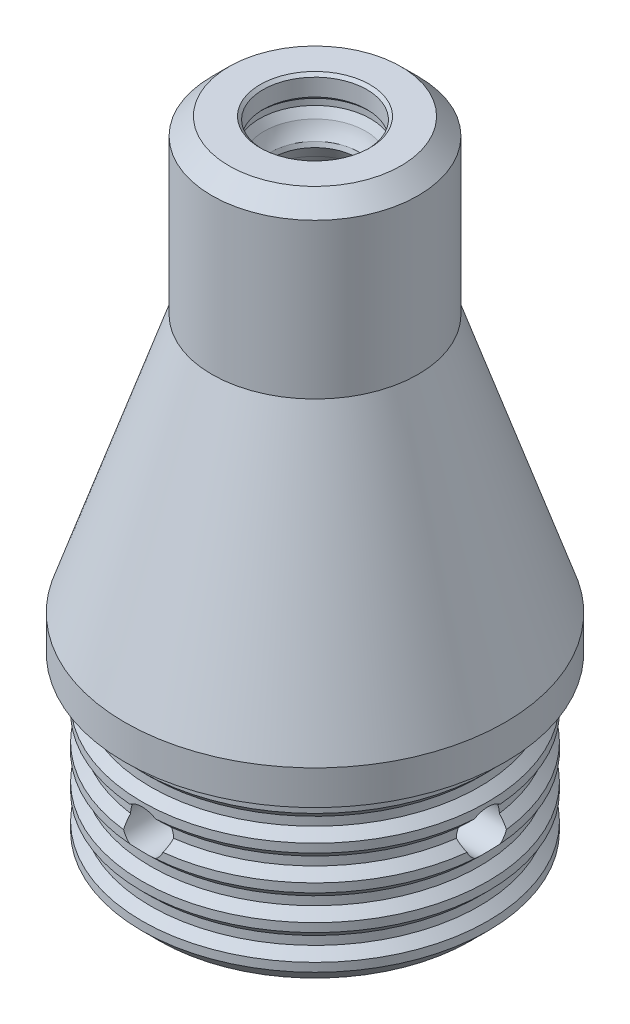
from build123d import *

# Parameters (mm, degrees)
CHAMFER_1_SIZE           = 1
CHAMFER_2_SIZE           = 0.1
CHAMFER_3_SIZE           = 1
SKETCH_2_R               = 1.25
CUT_EXTRUDE_1_DEPTH      = 5
PATTERN_CIRCULAR_1_COUNT = 4
CHAMFER_4_SIZE           = 0.5


with BuildPart() as part:
    # 스케치1 → 회전1 (revolve)
    with BuildSketch(Plane(origin=(0, 0, 0), x_dir=(0, 0, -1), z_dir=(1, 0, 0))):
        with BuildLine():
            Line((4.2, 0), (4.2, 1))
            Line((4.2, 1), (4.7, 1.500000078))
            Line((4.7, 1.500000078), (4.7, 2.000000078))
            Line((4.7, 2.000000078), (4.2, 2.5))
            Line((4.2, 2.5), (4.2, 4))
            Line((4.2, 4), (4.7, 4.500000078))
            Line((4.7, 4.500000078), (4.7, 5.000000078))
            Line((4.7, 5.000000078), (4.2, 5.5))
            Line((4.2, 5.5), (4.2, 7))
            Line((4.2, 7), (4.7, 7.500000078))
            Line((4.7, 7.500000078), (4.7, 8.000000078))
            Line((4.7, 8.000000078), (4.2, 8.5))
            Line((4.2, 8.5), (4.2, 10))
            Line((4.2, 10), (4.7, 10.500000078))
            Line((4.7, 10.500000078), (4.7, 11.000000078))
            Line((4.7, 11.000000078), (4.2, 11.5))
            Line((4.2, 11.5), (4.2, 13))
            Line((4.2, 13), (4.7, 13.500000078))
            Line((4.7, 13.500000078), (4.7, 14.000000078))
            Line((4.7, 14.000000078), (4.2, 14.5))
            Line((4.2, 14.5), (4.2, 28))
            Line((4.2, 28), (3.533728258, 29.430530536))
            Line((3.533728258, 29.430530536), (2.802745502, 31))
            Line((2.802745502, 31), (2.399244734, 31.778552392))
            ThreePointArc((2.399244734, 31.778552392), (2.719290067, 32.253174869), (2.946609162, 32.778552392))
            Line((2.946609162, 32.778552392), (3.229990685, 33.260397004))
            Line((3.229990685, 33.260397004), (3.229990685, 33.62037773))
            Line((3.229990685, 33.62037773), (3.02, 33.830368416))
            Line((3.02, 33.830368416), (3.02, 34.830368416))
            Line((3.02, 34.830368416), (3.189631584, 35))
            Line((3.189631584, 35), (6, 35))
            Line((6, 35), (6, 25))
            Line((6, 25), (11.05, 10))
            Line((11.05, 10), (11.05, 8))
            Line((11.05, 8), (10.05, 8))
            Line((10.05, 8), (10.05, 7))
            Line((10.05, 7), (9.55, 6.5))
            Line((9.55, 6.5), (9.55, 6))
            Line((9.55, 6), (10.05, 5.5))
            Line((10.05, 5.5), (10.05, 5))
            Line((10.05, 5), (9.55, 4.5))
            Line((9.55, 4.5), (9.55, 4))
            Line((9.55, 4), (10.05, 3.5))
            Line((10.05, 3.5), (10.05, 3))
            Line((10.05, 3), (9.55, 2.5))
            Line((9.55, 2.5), (9.55, 2))
            Line((9.55, 2), (10.05, 1.5))
            Line((10.05, 1.5), (10.05, 1))
            Line((10.05, 1), (9.55, 0.5))
            Line((9.55, 0.5), (9.55, 0))
            Line((9.55, 0), (10.05, -0.5))
            Line((10.05, -0.5), (10.05, -1))
            Line((10.05, -1), (10.05, -1.999374902))
            Line((10.05, -1.999374902), (4.2, -1.999374902))
            Line((4.2, -1.999374902), (4.2, 0))
        make_face()
    revolve(axis=Axis((0, 0, 0), (0, 1, 0)))

    # 모따기1
    chamfer_1_edges = [part.edges().sort_by_distance(p)[0] for p in [
        (0, 35, 6),
        (0, -1.999374902, 4.2),
    ]]
    chamfer(chamfer_1_edges, length=CHAMFER_1_SIZE)

    # 모따기2
    # the kernel refuses this chamfer: 0.191354542, 0.1 mm, written as the material it takes off along each edge
    with BuildSketch(Plane(origin=(0, 31.778552392, 0), x_dir=(0, 0, -1), z_dir=(1, 0, 0))) as chamfer_2_piece_1:
        with BuildLine():
            Line((2.399244734 + CHAMFER_2_SIZE * 0.460143640426, -CHAMFER_2_SIZE * 0.887844485355), (2.52619809, 0.166311611))
            ThreePointArc((2.52619809, 0.166311611), (2.466310937, 0.08495162), (2.399244734, 0))
            Line((2.399244734, 0), (2.399244734 + CHAMFER_2_SIZE * 0.460143640426, -CHAMFER_2_SIZE * 0.887844485355))
        make_face()
    revolve(axis=Axis((0, 31.778552392, 0), (0, 1, 0)), mode=Mode.SUBTRACT)

    # 모따기3
    chamfer_3_edges = [part.edges().sort_by_distance(p)[0] for p in [
        (0, -1.999374902, 10.05),
    ]]
    chamfer(chamfer_3_edges, length=CHAMFER_3_SIZE)

    # 스케치2 → 컷-돌출1 (cut)
    with BuildSketch(Plane.ZY.offset(11.05)):
        with Locations((0, 4)):
            Circle(SKETCH_2_R)
    cut_extrude_1 = extrude(amount=-CUT_EXTRUDE_1_DEPTH, mode=Mode.SUBTRACT)

    # 원형 패턴1: 컷-돌출1 ×4 about axis
    pattern_circular_1_axis = Axis((0, 0, 0), (0, 1, 0))
    for i in range(1, PATTERN_CIRCULAR_1_COUNT):
        add(cut_extrude_1.rotate(pattern_circular_1_axis, i * 360 / PATTERN_CIRCULAR_1_COUNT), mode=Mode.SUBTRACT)

    # 모따기4
    chamfer_4_edges = [part.edges().sort_by_distance(p)[0] for p in [
        (-6.05, 4, -1.25),
        (1.25, 4, -6.05),
        (6.05, 4, 1.25),
        (-1.25, 4, 6.05),
    ]]
    chamfer(chamfer_4_edges, length=CHAMFER_4_SIZE)


solid = part.part
